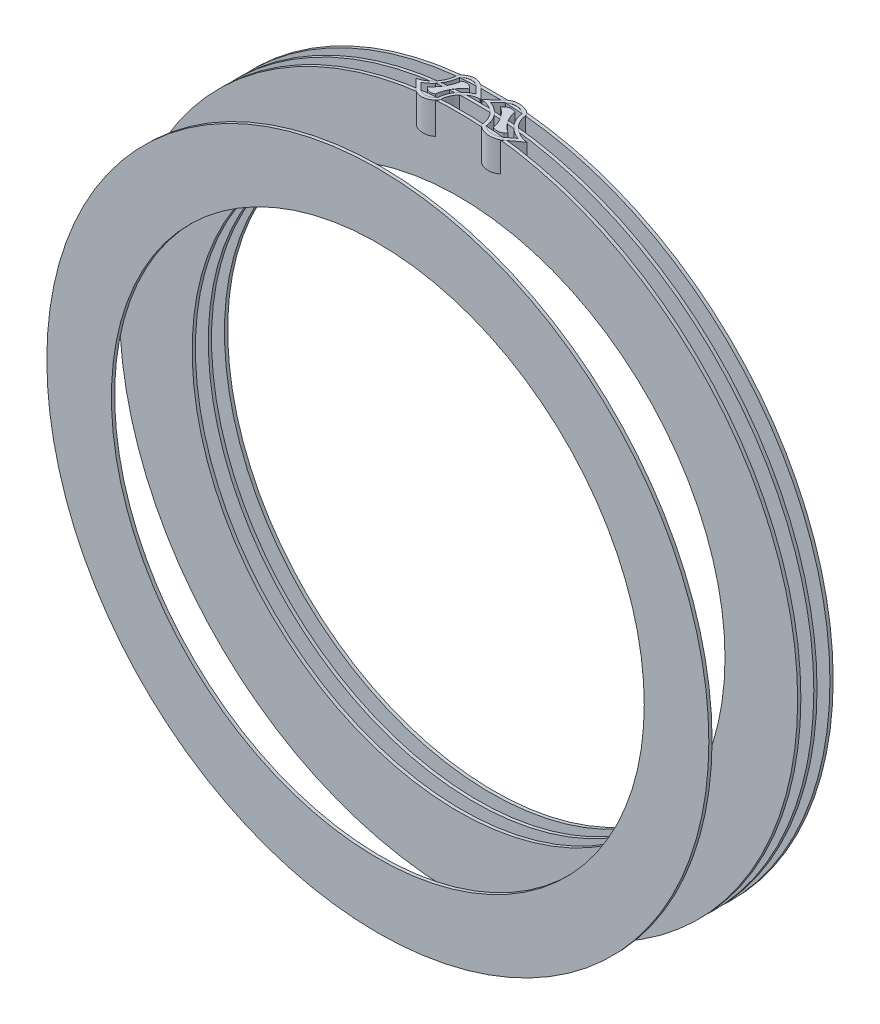
from build123d import *

# Parameters (mm, degrees)
SKETCH1_R                = 13.0175
SKETCH1_R_2              = 12.3825
SKETCH1_R_3              = 10.4775
BOSS_EXTRUDE1_DEPTH      = 0.0635
BOSS_EXTRUDE3_REACH      = 30.259
BOSS_EXTRUDE3_END_RADIUS = 13.335
SKETCH4_R                = 13.335
SKETCH4_R_2              = 10.4775
BOSS_EXTRUDE4_DEPTH      = 0.0635
SKETCH9_R                = 13.335
SKETCH9_R_2              = 10.4775
BOSS_EXTRUDE5_DEPTH      = 0.0635
SKETCH10_R               = 13.335
SKETCH10_R_2             = 10.4775
BOSS_EXTRUDE6_DEPTH      = 0.0635


with BuildPart() as part:
    # Sketch1 → Boss-Extrude1 (new, symmetric)
    # profile 1 of 2: a face of its own
    with BuildSketch(Plane.XY):
        Circle(SKETCH1_R)
        Circle(SKETCH1_R_2, mode=Mode.SUBTRACT)
    # profile 2 of 2: a face of its own
    with BuildSketch(Plane.XY):
        Circle(SKETCH1_R_2)
        Circle(SKETCH1_R_3, mode=Mode.SUBTRACT)
    extrude(amount=BOSS_EXTRUDE1_DEPTH, both=True)


with BuildPart() as body_2:
    # Boss-Extrude3: up to this cylinder (the profile starts inside it)
    boss_extrude3_end = Plane(origin=(0, 0, -4.0107315), z_dir=(0, 0, -1)) * Cylinder(BOSS_EXTRUDE3_END_RADIUS, 89.372447, mode=Mode.PRIVATE)
    # Sketch3 → Boss-Extrude3 (new, up to the surface)
    with BuildSketch(Plane(origin=(0, 12.065, 0), x_dir=(1, 0, 0), z_dir=(0, 1, 0)), mode=Mode.PRIVATE) as boss_extrude3_sk1:
        with BuildLine():
            Line((0.460039804, 4.445004699), (0.03216311, 4.017128005))
            ThreePointArc((0.03216311, 4.017128005), (0.029324213, 4.003500425), (0.040684587, 3.995456038))
            ThreePointArc((0.040684587, 3.995456038), (0.584364457, 3.762630541), (0.830499923, 3.224845413))
            ThreePointArc((0.830499923, 3.224845413), (0.844051449, 3.175009397), (0.876325349, 3.134689828))
            ThreePointArc((0.876325349, 3.134689828), (1.310980159, 2.989724348), (1.730039804, 3.175004699))
            Line((1.730039804, 3.175004699), (2.178784076, 3.623749188))
            ThreePointArc((2.178784076, 3.623749188), (1.620796803, 3.842668346), (1.360187679, 4.382444484))
            ThreePointArc((1.360187679, 4.382444484), (1.34655763, 4.445), (1.304234905, 4.493039127))
            ThreePointArc((1.304234905, 4.493039127), (0.872979662, 4.629966452), (0.460039804, 4.445004699))
        make_face()
        with BuildLine():
            Line((1.640237243, 3.26480726), (1.9111001, 3.53567023))
            ThreePointArc((1.9111001, 3.53567023), (1.437467163, 3.85446617), (1.232813929, 4.387454034))
            ThreePointArc((1.232813929, 4.387454034), (0.885090081, 4.503426418), (0.549842365, 4.355202137))
            Line((0.549842365, 4.355202137), (0.278976021, 4.084335794))
            ThreePointArc((0.278976021, 4.084335794), (0.752610048, 3.765541996), (0.957265678, 3.232555363))
            ThreePointArc((0.957265678, 3.232555363), (1.304989527, 3.11658298), (1.640237243, 3.26480726))
        make_face(mode=Mode.SUBTRACT)
    boss_extrude3_tool1 = extrude(boss_extrude3_sk1.sketch, amount=BOSS_EXTRUDE3_REACH, mode=Mode.PRIVATE) & boss_extrude3_end
    add(boss_extrude3_tool1.solids().sort_by_distance((0.874517, 12.065, -4.602955))[0])
    # Sketch3 → Boss-Extrude3 (new, up to the surface)
    with BuildSketch(Plane(origin=(0, 12.065, 0), x_dir=(1, 0, 0), z_dir=(0, 1, 0)), mode=Mode.PRIVATE) as boss_extrude3_sk2:
        with BuildLine():
            Line((-1.730039804, 3.175004699), (-2.178784076, 3.623749188))
            ThreePointArc((-2.178784076, 3.623749188), (-1.620796803, 3.842668346), (-1.360187679, 4.382444484))
            ThreePointArc((-1.360187679, 4.382444484), (-1.34655763, 4.445), (-1.304234905, 4.493039127))
            ThreePointArc((-1.304234905, 4.493039127), (-0.872979662, 4.629966452), (-0.460039804, 4.445004699))
            Line((-0.460039804, 4.445004699), (-0.03216311, 4.017128005))
            ThreePointArc((-0.03216311, 4.017128005), (-0.029324213, 4.003500425), (-0.040684587, 3.995456038))
            ThreePointArc((-0.040684587, 3.995456038), (-0.584364457, 3.762630541), (-0.830499923, 3.224845413))
            ThreePointArc((-0.830499923, 3.224845413), (-0.844051449, 3.175009397), (-0.876325349, 3.134689828))
            ThreePointArc((-0.876325349, 3.134689828), (-1.310980159, 2.989724348), (-1.730039804, 3.175004699))
        make_face()
        with BuildLine():
            ThreePointArc((-1.232813929, 4.387454034), (-1.437467163, 3.85446617), (-1.9111001, 3.53567023))
            Line((-1.9111001, 3.53567023), (-1.640237243, 3.26480726))
            ThreePointArc((-1.640237243, 3.26480726), (-1.304989527, 3.11658298), (-0.957265678, 3.232555363))
            ThreePointArc((-0.957265678, 3.232555363), (-0.752610048, 3.765541996), (-0.278976021, 4.084335794))
            Line((-0.278976021, 4.084335794), (-0.549842365, 4.355202137))
            ThreePointArc((-0.549842365, 4.355202137), (-0.885090081, 4.503426418), (-1.232813929, 4.387454034))
        make_face(mode=Mode.SUBTRACT)
    boss_extrude3_tool2 = extrude(boss_extrude3_sk2.sketch, amount=BOSS_EXTRUDE3_REACH, mode=Mode.PRIVATE) & boss_extrude3_end
    add(boss_extrude3_tool2.solids().sort_by_distance((-1.935281, 12.065, -3.418508))[0])
    # Sketch3 → Boss-Extrude3 (new, up to the surface)
    with BuildSketch(Plane(origin=(0, 12.065, 0), x_dir=(1, 0, 0), z_dir=(0, 1, 0)), mode=Mode.PRIVATE) as boss_extrude3_sk3:
        with BuildLine():
            ThreePointArc((-1.052713427, 4.279131116), (-0.859118112, 4.309540606), (-0.684546207, 4.220498296))
            Line((-0.684546207, 4.220498296), (-0.608292834, 4.144244923))
            ThreePointArc((-0.608292834, 4.144244923), (-0.961843799, 3.801183986), (-1.137365744, 3.340878503))
            ThreePointArc((-1.137365744, 3.340878503), (-1.330961254, 3.310468752), (-1.505533401, 3.399511102))
            Line((-1.505533401, 3.399511102), (-1.581784051, 3.475761789))
            ThreePointArc((-1.581784051, 3.475761789), (-1.228233763, 3.818824337), (-1.052713427, 4.279131116))
        make_face()
    boss_extrude3_tool3 = extrude(boss_extrude3_sk3.sketch, amount=BOSS_EXTRUDE3_REACH, mode=Mode.PRIVATE) & boss_extrude3_end
    add(boss_extrude3_tool3.solids().sort_by_distance((-1.095038, 12.065, -3.810005))[0])
    # Sketch3 → Boss-Extrude3 (new, up to the surface)
    with BuildSketch(Plane(origin=(0, 12.065, 0), x_dir=(1, 0, 0), z_dir=(0, 1, 0)), mode=Mode.PRIVATE) as boss_extrude3_sk4:
        with BuildLine():
            ThreePointArc((1.052713427, 4.279131116), (0.859118112, 4.309540606), (0.684546207, 4.220498296))
            Line((0.684546207, 4.220498296), (0.608292834, 4.144244923))
            ThreePointArc((0.608292834, 4.144244923), (0.961843799, 3.801183986), (1.137365744, 3.340878503))
            ThreePointArc((1.137365744, 3.340878503), (1.330961254, 3.310468752), (1.505533401, 3.399511102))
            Line((1.505533401, 3.399511102), (1.581784051, 3.475761789))
            ThreePointArc((1.581784051, 3.475761789), (1.228233763, 3.818824337), (1.052713427, 4.279131116))
        make_face()
    boss_extrude3_tool4 = extrude(boss_extrude3_sk4.sketch, amount=BOSS_EXTRUDE3_REACH, mode=Mode.PRIVATE) & boss_extrude3_end
    add(boss_extrude3_tool4.solids().sort_by_distance((1.095038, 12.065, -3.810005))[0])


with BuildPart() as body_3:
    # Sketch4 → Boss-Extrude4 (new, symmetric)
    with BuildSketch(Plane.XY.offset(-3.175)):
        Circle(SKETCH4_R)
        Circle(SKETCH4_R_2, mode=Mode.SUBTRACT)
    extrude(amount=BOSS_EXTRUDE4_DEPTH, both=True)


with BuildPart() as body_4:
    # Sketch9 → Boss-Extrude5 (new, symmetric)
    with BuildSketch(Plane.XY.offset(-3.81)):
        Circle(SKETCH9_R)
        Circle(SKETCH9_R_2, mode=Mode.SUBTRACT)
    extrude(amount=BOSS_EXTRUDE5_DEPTH, both=True)


with BuildPart() as body_5:
    # Sketch10 → Boss-Extrude6 (new, symmetric)
    with BuildSketch(Plane.XY.offset(-4.445)):
        Circle(SKETCH10_R)
        Circle(SKETCH10_R_2, mode=Mode.SUBTRACT)
    extrude(amount=BOSS_EXTRUDE6_DEPTH, both=True)


solid = Compound([part.part, body_2.part, body_3.part, body_4.part, body_5.part])
